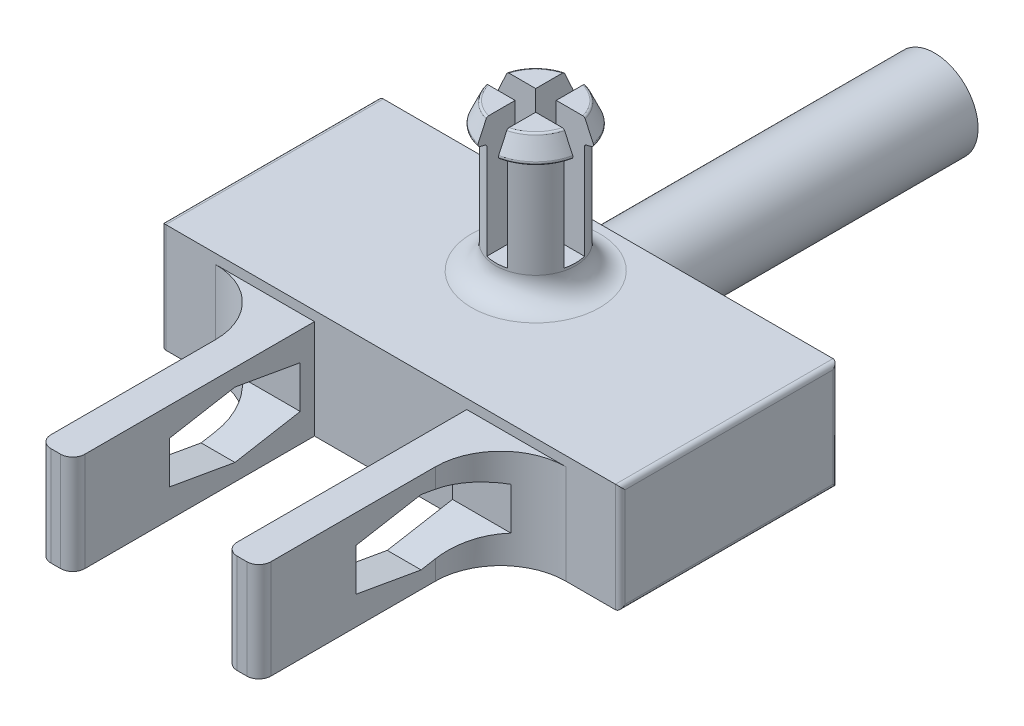
from build123d import *

# Parameters (mm, degrees)
DODANIE_WYCI_GNI_CIE1_DEPTH     = 4.5
DODANIE_WYCI_GNI_CIE2_DEPTH     = 4.1
SZKIC2_R                        = 1.8
DODANIE_WYCI_GNI_CIE3_DEPTH     = 13.5
WYTNIJ_WYCI_GNI_CIE2_DEPTH      = 23.456012558
WYTNIJ_WYCI_GNI_CIE2_DEPTH_BACK = 23.456012558
ZAOKR_GLENIE1_R                 = 0.5
ZAOKR_GLENIE2_R                 = 0.2
SZKIC4_R                        = 1.65
DODANIE_WYCI_GNI_CIE4_DEPTH     = 5.1
SZKIC5_R                        = 1.65
DODANIE_WYCI_GNI_CIE5_DEPTH     = 1
ZAOKR_GLENIE4_R                 = 1
ZAOKR_GLENIE5_R                 = 0.1
WYTNIJ_WYCI_GNI_CIE3_DEPTH      = 5


with BuildPart() as part:
    # Szkic1 → Dodanie-wyciągnięcie1 (new body)
    with BuildSketch(Plane(origin=(0, 0, 0), x_dir=(1, 0, 0), z_dir=(0, 1, 0))):
        Polygon((3.15, -4.5), (4.55, -4.5), (7.25, -4.5), (9.5, -4.5), (9.5, 4.5), (2.579268293, 4.5), (-2.579268293, 4.5), (-9.5, 4.5), (-9.5, -4.5), (-7.25, -4.5), (-4.55, -4.5), (-3.15, -4.5), align=None)
    extrude(amount=DODANIE_WYCI_GNI_CIE1_DEPTH)

    # Szkic1<7> → Dodanie-wyciągnięcie2 (add)
    with BuildSketch(Plane(origin=(0, 0, 0), x_dir=(1, 0, 0), z_dir=(0, 1, 0))):
        with BuildLine():
            Line((4.55, -14.5), (4.55, -7.2))
            ThreePointArc((4.55, -7.2), (5.340811691, -5.290811691), (7.25, -4.5))
            Line((7.25, -4.5), (3.15, -4.5))
            Line((3.15, -4.5), (3.15, -14.5))
            Line((3.15, -14.5), (4.55, -14.5))
        make_face()
        with BuildLine():
            Line((-3.15, -14.5), (-3.15, -4.5))
            Line((-3.15, -4.5), (-7.25, -4.5))
            ThreePointArc((-7.25, -4.5), (-5.340811691, -5.290811691), (-4.55, -7.2))
            Line((-4.55, -7.2), (-4.55, -14.5))
            Line((-4.55, -14.5), (-3.15, -14.5))
        make_face()
    extrude(amount=DODANIE_WYCI_GNI_CIE2_DEPTH)

    # Szkic2 → Dodanie-wyciągnięcie3 (add)
    with BuildSketch(Plane(origin=(0, 0, -4.5), x_dir=(-1, 0, 0), z_dir=(0, 0, -1))):
        with Locations((0, 2.25)):
            Circle(SZKIC2_R)
    extrude(amount=DODANIE_WYCI_GNI_CIE3_DEPTH)

    # Szkic3 → Wytnij-wyciągnięcie2 (cut, two sides: drawn at the far end of the back side and taken through both)
    with BuildSketch(Plane(origin=(-3.15, 0, 0), x_dir=(0, 0, -1), z_dir=(1, 0, 0)).offset(-WYTNIJ_WYCI_GNI_CIE2_DEPTH_BACK)):
        Polygon((-7.790001582, 3.4), (-10.490001582, 2.923917152), (-10.490001582, 1.176082848), (-7.790001582, 0.7), (-5.090001582, 1.176082848), (-5.090001582, 2.923917152), align=None)
    extrude(amount=WYTNIJ_WYCI_GNI_CIE2_DEPTH + WYTNIJ_WYCI_GNI_CIE2_DEPTH_BACK, mode=Mode.SUBTRACT)

    # Zaokrąglenie1
    zaokr_glenie1_edges = [part.edges().sort_by_distance(p)[0] for p in [
        (3.15, 2.05, 14.5),
        (4.55, 2.05, 14.5),
        (-4.55, 2.05, 14.5),
        (-3.15, 2.05, 14.5),
    ]]
    fillet(zaokr_glenie1_edges, radius=ZAOKR_GLENIE1_R)

    # Zaokrąglenie2
    zaokr_glenie2_edges = [part.edges().sort_by_distance(p)[0] for p in [
        (-9.5, 2.25, -4.5),
        (-9.5, 4.5, 0),
        (9.5, 0, 0),
        (-9.5, 2.25, 4.5),
        (9.5, 2.25, 4.5),
        (9.5, 2.25, -4.5),
        (9.5, 4.5, 0),
        (-9.5, 0, 0),
    ]]
    fillet(zaokr_glenie2_edges, radius=ZAOKR_GLENIE2_R)

    # Szkic4 → Dodanie-wyciągnięcie4 (add)
    with BuildSketch(Plane(origin=(0, 4.5, 0), x_dir=(1, 0, 0), z_dir=(0, 1, 0))):
        with Locations((0, 1.5)):
            Circle(SZKIC4_R)
    extrude(amount=DODANIE_WYCI_GNI_CIE4_DEPTH)

    # Szkic5 → Dodanie-wyciągnięcie5 (add)
    with BuildSketch(Plane(origin=(0, 9.6, 0), x_dir=(1, 0, 0), z_dir=(0, 1, 0))):
        with Locations((0, 1.5)):
            Circle(SZKIC5_R)
    extrude(amount=DODANIE_WYCI_GNI_CIE5_DEPTH)

    # Zaokrąglenie4
    zaokr_glenie4_edges = [part.edges().sort_by_distance(p)[0] for p in [
        (-1.65, 4.5, -1.5),
    ]]
    fillet(zaokr_glenie4_edges, radius=ZAOKR_GLENIE4_R)

    # Szkic7 → Obrót1 (revolve)
    with BuildSketch(Plane(origin=(0, 0, 0), x_dir=(0, 0, -1), z_dir=(1, 0, 0))):
        Polygon((3.15, 10.6), (3.15, 9.6), (3.55, 9.707179677), align=None)
    revolve(axis=Axis((0, 16.6, -1.5), (0, -1, 0)))

    # Zaokrąglenie5
    zaokr_glenie5_edges = [part.edges().sort_by_distance(p)[0] for p in [
        (-1.166726189, 9.6, -0.333273811),
        (0, 9.707179677, 0.55),
        (0, 10.6, 0.15),
    ]]
    fillet(zaokr_glenie5_edges, radius=ZAOKR_GLENIE5_R)

    # Szkic6 → Wytnij-wyciągnięcie3 (cut)
    with BuildSketch(Plane(origin=(0, 10.6, 0), x_dir=(1, 0, 0), z_dir=(0, 1, 0))):
        with BuildLine():
            Line((0.425, 4.714465969), (0.425, 1.925))
            Line((0.425, 1.925), (3.214465969, 1.925))
            ThreePointArc((3.214465969, 1.925), (3.242439894, 1.5), (3.214465969, 1.075))
            Line((3.214465969, 1.075), (0.425, 1.075))
            Line((0.425, 1.075), (0.425, -1.714465969))
            ThreePointArc((0.425, -1.714465969), (0, -1.742439894), (-0.425, -1.714465969))
            Line((-0.425, -1.714465969), (-0.425, 1.075))
            Line((-0.425, 1.075), (-3.214465969, 1.075))
            ThreePointArc((-3.214465969, 1.075), (-3.242439894, 1.5), (-3.214465969, 1.925))
            Line((-3.214465969, 1.925), (-0.425, 1.925))
            Line((-0.425, 1.925), (-0.425, 4.714465969))
            ThreePointArc((-0.425, 4.714465969), (0, 4.742439894), (0.425, 4.714465969))
        make_face()
    extrude(amount=-WYTNIJ_WYCI_GNI_CIE3_DEPTH, mode=Mode.SUBTRACT)


solid = part.part
